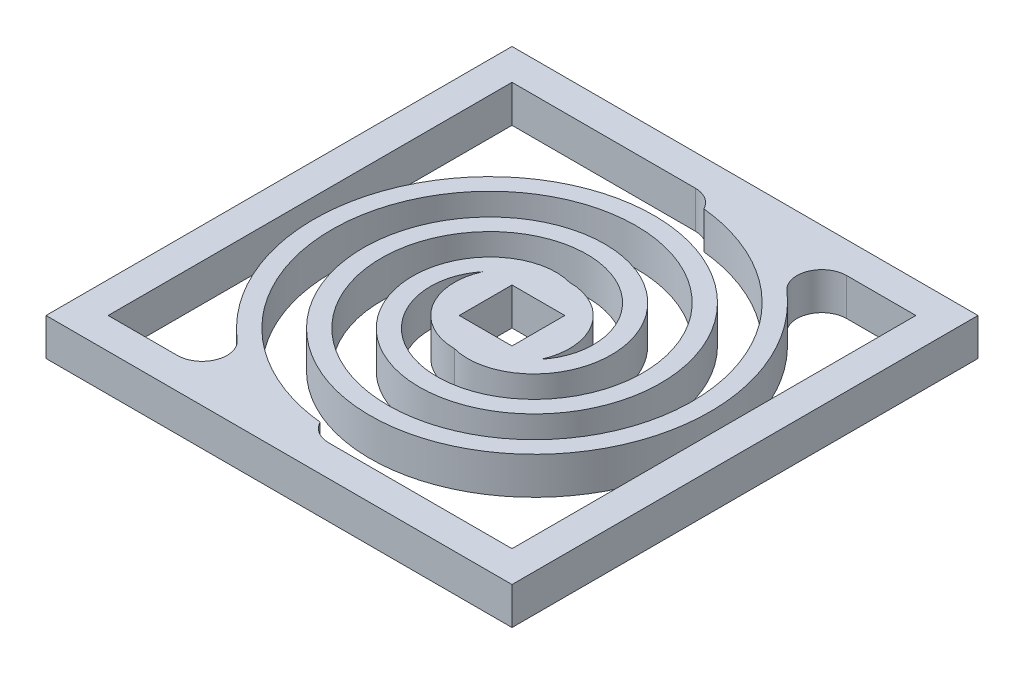
from build123d import *

# Parameters (mm, degrees)
SKETCH1_W           = 1.5
SKETCH1_H           = 5
BOSS_EXTRUDE1_DEPTH = 8
SKETCH2_W           = 1.5
SKETCH2_H           = 1.5
BOSS_EXTRUDE2_DEPTH = 8
SKETCH3_W           = 15
SKETCH3_H           = 15
SKETCH3_W_2         = 13
SKETCH3_H_2         = 13
SKETCH3_R           = 1.85
SKETCH3_W_3         = 1.7
SKETCH3_H_3         = 1.7
BOSS_EXTRUDE3_DEPTH = 1.2
SWEEP1_START        = -1.2
SWEEP1_DEPTH        = 1.2
CIRPATTERN2_COUNT   = 2
FILLET3_R           = 0.8
CUT_EXTRUDE1_DEPTH  = 1.6


# Read off the part's stored shape, not the designer's step: Sweep1
with BuildPart() as part:
    # Sketch1 → Boss-Extrude1 (new body)
    with BuildSketch(Plane(origin=(0, 0, 0), x_dir=(1, 0, 0), z_dir=(0, 1, 0))):
        Rectangle(SKETCH1_W, SKETCH1_H)
    extrude(amount=BOSS_EXTRUDE1_DEPTH)

    # Sketch2 → Boss-Extrude2 (add)
    with BuildSketch(Plane.XZ):
        Rectangle(SKETCH2_W, SKETCH2_H)
    extrude(amount=BOSS_EXTRUDE2_DEPTH)

    # Sketch3 → Boss-Extrude3 (add)
    # profile 1 of 2: a face of its own
    with BuildSketch(Plane.XZ):
        Rectangle(SKETCH3_W, SKETCH3_H)
        Rectangle(SKETCH3_W_2, SKETCH3_H_2, mode=Mode.SUBTRACT)
    # profile 2 of 2: a face of its own
    with BuildSketch(Plane.XZ):
        with Locations(Location((0, 0, 0), (0, 0, 66.083465578))):
            Circle(SKETCH3_R)
        Rectangle(SKETCH3_W_3, SKETCH3_H_3, mode=Mode.SUBTRACT)
    extrude(amount=BOSS_EXTRUDE3_DEPTH)


with BuildPart() as boss_extrude3_piece_1:
    # of the separate pieces the step leaves, piece 1, a body of its own (boss_extrude3_pieces)
    add(part.part.solids().sort_by_distance((0.75, 0, -2.5))[0])



with BuildPart() as boss_extrude3_piece_2:
    # of the separate pieces the step leaves, piece 2, a body of its own (boss_extrude3_pieces)
    add(part.part.solids().sort_by_distance((-7.5, 0, -7.5))[0])


with BuildPart() as boss_extrude3_piece_1_1:
    add(boss_extrude3_piece_1.part)

    add(boss_extrude3_piece_2.part)  # Sweep1 merges Boss-Extrude3 piece 2
    # Sweep1 outline → Sweep1 (add)
    with BuildSketch(Plane(origin=(0, 0, 0), x_dir=(1, 0, 0), z_dir=(0, 1, 0)).offset(SWEEP1_START)):
        with BuildLine():
            add(Edge.make_bspline(
                [(-1.691897861, 0.748319202), (-1.693163504, 0.746784611), (-1.694426991, 0.745247382), (-1.853220531, 0.551386567), (-1.978707364, 0.311918606), (-2.125013397, -0.217494132), (-2.145069321, -0.513615483), (-2.059157744, -1.108754729), (-1.950089737, -1.413058858), (-1.606646572, -1.968877639), (-1.367401578, -2.223977533), (-0.788989663, -2.62780751), (-0.444003714, -2.777902199), (0.297874854, -2.931028384), (0.700594437, -2.933043256), (1.493927257, -2.771508946), (1.889458602, -2.604773973), (2.59871441, -2.115370005), (2.915694268, -1.78788872), (3.404784293, -1.015946068), (3.578007202, -0.56582859), (3.73535564, 0.387244565), (3.718312626, 0.895802339), (3.479550265, 1.885530976), (3.254598183, 2.371376752), (2.618552361, 3.232156899), (2.202694656, 3.610123988), (1.237298759, 4.182748957), (0.682226939, 4.378347606), (-0.481420519, 4.53857303), (-1.095429987, 4.501928996), (-2.28061863, 4.185064327), (-2.856289797, 3.901585226), (-3.8675524, 3.118500834), (-4.306008503, 2.614177546), (-4.961192023, 1.455351845), (-5.178731191, 0.795418867), (-5.341045064, -0.578458244), (-5.284475034, -1.297697465), (-4.888977162, -2.677799118), (-4.546778497, -3.343003776), (-3.616402637, -4.504119251), (-3.023553469, -5.002758099), (-1.671302056, -5.739893579), (-0.906562014, -5.979098718), (-0.114613579, -6.06104862)],
                knots=[0.09349979, 0.09349979, 0.09349979, 0.09349979, 0.09375, 0.09375, 0.125, 0.125, 0.15625, 0.15625, 0.1875, 0.1875, 0.21875, 0.21875, 0.25, 0.25, 0.28125, 0.28125, 0.3125, 0.3125, 0.34375, 0.34375, 0.375, 0.375, 0.40625, 0.40625, 0.4375, 0.4375, 0.46875, 0.46875, 0.5, 0.5, 0.53125, 0.53125, 0.5625, 0.5625, 0.59375, 0.59375, 0.625, 0.625, 0.65625, 0.65625, 0.6875, 0.6875, 0.71875, 0.71875, 0.75, 0.75, 0.75, 0.75], degree=3))
            ThreePointArc((-1.691897861, 0.748319202), (-1.009482411, 1.550304893), (0, 1.85))
            add(Edge.make_bspline(
                [(0, 1.85), (-0.24216446, 1.91666668), (-0.511071124, 1.935052118), (-1.057930949, 1.852853965), (-1.335589871, 1.752109953), (-1.846390644, 1.429870563), (-2.079184863, 1.2083542), (-2.447824847, 0.666794619), (-2.583333461, 0.346884052), (-2.716666539, -0.346884052), (-2.714230217, -0.720469413), (-2.551883118, -1.460826151), (-2.391843399, -1.827227219), (-1.921507966, -2.486124147), (-1.611249372, -2.778213942), (-0.876192939, -3.22700302), (-0.451603808, -3.383333431), (0.451603808, -3.516666569), (0.92986771, -3.493408335), (1.863721346, -3.250912253), (2.318864578, -3.031576858), (3.125857637, -2.413145358), (3.477243033, -2.014144549), (4.00618118, -1.085591254), (4.183333413, -0.556323564), (4.316666587, 0.556323564), (4.272586461, 1.13926601), (3.949941379, 2.266616538), (3.671310321, 2.810501943), (2.904782744, 3.765591122), (2.417039728, 4.176272131), (1.294989566, 4.785359335), (0.66104332, 4.9833334), (-0.66104332, 5.1166666), (-1.348664313, 5.051764592), (-2.669511727, 4.6489705), (-3.302139311, 4.311043788), (-4.405324604, 3.396420127), (-4.875301232, 2.819934909), (-5.564537485, 1.504387877), (-5.783333391, 0.765763075), (-5.916666609, -0.765763075), (-5.830942725, -1.558062617), (-5.347999618, -3.072406915), (-4.950777256, -3.793776681), (-3.888057509, -5.045058084), (-3.222830091, -5.574330336), (-2.001290759, -6.197131568), (-1.500260426, -6.379660655), (-0.979824705, -6.500000001)],
                knots=[0, 0, 0, 0, 0.03125, 0.03125, 0.0625, 0.0625, 0.09375, 0.09375, 0.125, 0.125, 0.15625, 0.15625, 0.1875, 0.1875, 0.21875, 0.21875, 0.25, 0.25, 0.28125, 0.28125, 0.3125, 0.3125, 0.34375, 0.34375, 0.375, 0.375, 0.40625, 0.40625, 0.4375, 0.4375, 0.46875, 0.46875, 0.5, 0.5, 0.53125, 0.53125, 0.5625, 0.5625, 0.59375, 0.59375, 0.625, 0.625, 0.65625, 0.65625, 0.6875, 0.6875, 0.71875, 0.71875, 0.738092437, 0.738092437, 0.738092437, 0.738092437], degree=3))
            Line((-0.979824705, -6.500000001), (-0.029190927, -6.5))
            Line((-0.029190927, -6.5), (-0.114613579, -6.06104862))
        make_face()
    sweep1 = extrude(amount=SWEEP1_DEPTH)

    # CirPattern2: Sweep1 ×2 about axis
    cirpattern2_axis = Axis((0, 8, 0), (0, 1, 0))
    for i in range(1, CIRPATTERN2_COUNT):
        add(sweep1.rotate(cirpattern2_axis, i * 360 / CIRPATTERN2_COUNT))

    # Fillet3
    # the kernel refuses this fillet: 0.8 mm, written as the material it adds along each edge
    with BuildSketch(Plane(origin=(0.029190927, -1.2, -6.5), x_dir=(-1, 0, 0), z_dir=(0, 1, 0)), Plane(origin=(-0.029190927, -1.2, 6.5), x_dir=(1, 0, 0), z_dir=(0, 1, 0))) as fillet3_piece_1:
        with BuildLine():
            CenterArc((0.628470823, 0.8), FILLET3_R, 206.827813059, 63.172186941)
            Line((-0.085422652, 0.43895138), (-0.099700522, 0.431730408))
            ThreePointArc((-0.099700522, 0.431730408), (-0.058416696, 0.216419328), (-0.01570537, -0.003056362))
            Line((-0.01570537, -0.003056362), (0, -0.016))
            Line((0, -0.016), (0.628470823, -0.016))
            Line((0.628470823, -0.016), (0.628470823, 0))
        make_face()
    fillet3_piece_1_solid = extrude(amount=1.2, mode=Mode.PRIVATE)
    with BuildSketch(Plane(origin=(-0.979824705, -1.2, 6.500000001), x_dir=(-0.8919059375124657, 0, -0.45222096217447677), z_dir=(0, 1, 0)), Plane(origin=(0.979824705, -1.2, -6.500000001), x_dir=(0.8919059375124657, 0, 0.45222096217447677), z_dir=(0, 1, 0))) as fillet3_piece_2:
        with BuildLine():
            CenterArc((3.299681481, 0.77607414), FILLET3_R, 116.886268111, 139.06572266)
            Line((2.937904711, 1.48959889), (2.930669176, 1.503869385))
            Line((2.930669176, 1.503869385), (-0.007235535, 0.014270495))
            Line((-0.007235535, 0.014270495), (0.00383462, -0.015533695))
            ThreePointArc((0.00383462, -0.015533695), (1.552597942, 0.17463645), (3.101609852, -0.015521483))
            Line((3.101609852, -0.015521483), (3.105493609, 0))
        make_face()
    fillet3_piece_2_solid = extrude(amount=1.2, mode=Mode.PRIVATE)
    add([fillet3_piece_1_solid, fillet3_piece_2_solid])

    # Sketch10 → Cut-Extrude1 (cut)
    with BuildSketch(Plane(origin=(0.75, 0, 0), x_dir=(0, 0, -1), z_dir=(1, 0, 0))):
        Polygon((0.85, 0), (1.691153453, 0), (2.5, 0), (2.5, 8), (-2.5, 8), (-2.5, 0), (-1.898827408, 0), (-0.85, 0), (-0.75, 0), (-0.75, -8), (0.75, -8), (0.75, 0), align=None)
    extrude(amount=-CUT_EXTRUDE1_DEPTH, mode=Mode.SUBTRACT)


solid = boss_extrude3_piece_1_1.part
